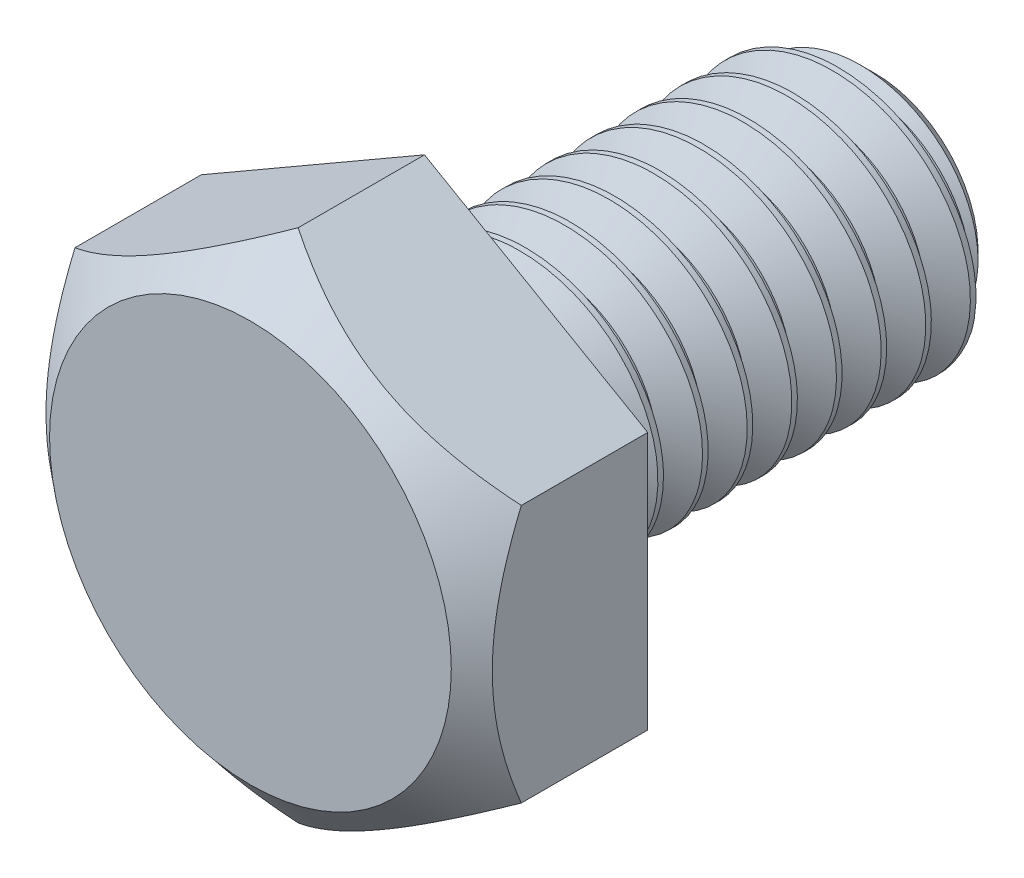
from build123d import *

# Parameters (mm, degrees)
BOSS_EXTRUDE1_DEPTH = 4
SKETCH4_OUTSIDE_W   = 56.54
SKETCH4_OUTSIDE_H   = 58.088
SKETCH4_OUTSIDE_R   = 4.5
CUT_EXTRUDE1_DEPTH  = 16.947831619
CUT_EXTRUDE1_DRAFT  = -50
SKETCH9_R           = 5.773502692
SKETCH9_R_2         = 4.75
CUT_EXTRUDE2_DEPTH  = 0.1
CUT_SWEEP1_PITCH    = 1
CUT_SWEEP1_TO       = 10
SKETCH8_R           = 3
BOSS_EXTRUDE2_DEPTH = 3
BOSS_EXTRUDE2_TAPER = 20


with BuildPart() as part:
    # Sketch2 → Revolve1 (revolve)
    with BuildSketch(Plane(origin=(0, 0, 0), x_dir=(0, 0, -1), z_dir=(1, 0, 0)), mode=Mode.PRIVATE) as revolve1_sk:
        Polygon((10, 0), (0, 0), (0, 3), (9.3, 3), (10, 2.3), align=None)
    revolve(revolve1_sk.sketch.rotate(Axis((0, 0, -10), (0, 0, 1)), 90), axis=Axis((0, 0, -10), (0, 0, 1)))

    # Sketch3 → Boss-Extrude1 (add)
    with BuildSketch(Plane.XY):
        Polygon((0, 5.773502692), (-5, 2.886751346), (-5, -2.886751346), (0, -5.773502692), (5, -2.886751346), (5, 2.886751346), align=None)
    extrude(amount=BOSS_EXTRUDE1_DEPTH)


with BuildPart() as cut_extrude1_tool:
    # Sketch4 outside → Cut-Extrude1 (with draft: the straight prism first)
    with BuildSketch(Plane.XY.offset(4)):
        Rectangle(SKETCH4_OUTSIDE_W, SKETCH4_OUTSIDE_H)
        Circle(SKETCH4_OUTSIDE_R, mode=Mode.SUBTRACT)
    extrude(amount=-CUT_EXTRUDE1_DEPTH)
    # Cut-Extrude1: the draft: its side faces are tilted about the plane it starts from
    cut_extrude1_sides = [cut_extrude1_tool.faces().sort_by_distance(p)[0] for p in [
        (0, -29.044, -4.473915809),
        (28.27, 0, -4.473915809),
        (0, 29.044, -4.473915809),
        (-28.27, 0, -4.473915809),
        (-4.5, 0, -4.473915809),
    ]]
    draft(cut_extrude1_sides, Plane.XY.offset(4), CUT_EXTRUDE1_DRAFT)


with BuildPart() as part_1:
    add(part.part)

    # Cut-Extrude1: cut by cut_extrude1_tool
    add(cut_extrude1_tool.part, mode=Mode.SUBTRACT)

    # Sketch9 → Cut-Extrude2 (cut)
    with BuildSketch(Plane(origin=(0, 0, 0), x_dir=(-1, 0, 0), z_dir=(0, 0, -1))):
        Circle(SKETCH9_R)
        Circle(SKETCH9_R_2, mode=Mode.SUBTRACT)
    extrude(amount=-CUT_EXTRUDE2_DEPTH, mode=Mode.SUBTRACT)


with BuildPart() as body_2:
    # Split1: read off the stored shape, not the designer's step
    # Split1: the piece on the far side of the plane
    add(part_1.part)
    split(bisect_by=Plane.XY, keep=Keep.BOTTOM)

    # Cut-Sweep1: arcs per turn and ends read off the stored shape
    # Cut-Sweep1: the profile of Sketch6 screwed along a right-hand helix through 11 turns, 8 arcs to a turn; built about Z, then put on its axis
    cut_sweep1_z = Axis((0, 0, 0), (0, 0, 1))
    cut_sweep1_corners = [(3.054126588, 0, 0.03125), (3.054126588, 0, -0.90625), (2.350480947, 0, -0.5), (2.350480947, 0, -0.375)]
    with BuildLine(mode=Mode.PRIVATE) as cut_sweep1_profile:
        Line(cut_sweep1_corners[0], cut_sweep1_corners[1])
        Line(cut_sweep1_corners[1], cut_sweep1_corners[2])
        Line(cut_sweep1_corners[2], cut_sweep1_corners[3])
        Line(cut_sweep1_corners[3], cut_sweep1_corners[0])
    cut_sweep1_cap = Face(cut_sweep1_profile.wire())
    cut_sweep1_turn_angles = [0, 22.5, 45, 67.5, 90, 112.5, 135, 157.5, 180, 202.5, 225, 247.5, 270, 292.5, 315, 337.5, 360]
    cut_sweep1_turn_weights = [1, 0.9238795325112867, 1, 0.9238795325112867, 1, 0.9238795325112867, 1, 0.9238795325112867, 1, 0.9238795325112867, 1, 0.9238795325112867, 1, 0.9238795325112867, 1, 0.9238795325112867, 1]
    cut_sweep1_turn_rails = [Edge.make_bspline([Vector(p[0], p[1], 0).rotate(cut_sweep1_z, cut_sweep1_turn_angles[k]) / cut_sweep1_turn_weights[k] + Vector(0, 0, p[2] + CUT_SWEEP1_PITCH * cut_sweep1_turn_angles[k] / 360) for k in range(17)], [0, 0, 0, 1, 1, 2, 2, 3, 3, 4, 4, 5, 5, 6, 6, 7, 7, 8, 8, 8], 2, cut_sweep1_turn_weights) for p in cut_sweep1_corners]
    cut_sweep1_turn_sides = [Face.make_surface_from_curves(cut_sweep1_turn_rails[p[0]], cut_sweep1_turn_rails[p[1]]) for p in [(0, 1), (1, 2), (2, 3), (3, 0)]]
    cut_sweep1 = Plane(origin=(0, 0, -10), x_dir=(0, 1, 0), z_dir=(0, 0, 1)) * split(Solid(Shell([*[p.moved(Location((0, 0, CUT_SWEEP1_PITCH * i))) for i in range(11) for p in cut_sweep1_turn_sides], cut_sweep1_cap, cut_sweep1_cap.rotate(cut_sweep1_z, 3960).moved(Location((0, 0, CUT_SWEEP1_PITCH * 3960 / 360)))])), bisect_by=Plane.XY.offset(CUT_SWEEP1_TO), keep=Keep.BOTTOM, mode=Mode.PRIVATE)
    add(cut_sweep1, mode=Mode.SUBTRACT)


with BuildPart() as part_2:
    add(part_1.part)

    # Split1
    split(bisect_by=Plane.XY, keep=Keep.TOP)

    add(body_2.part)  # Boss-Extrude2 merges body 2
    # Sketch8 → Boss-Extrude2 (add)
    with BuildSketch(Plane(origin=(0, 0, 0), x_dir=(-1, 0, 0), z_dir=(0, 0, -1))):
        Circle(SKETCH8_R)
    extrude(amount=BOSS_EXTRUDE2_DEPTH, taper=BOSS_EXTRUDE2_TAPER)


solid = part_2.part
